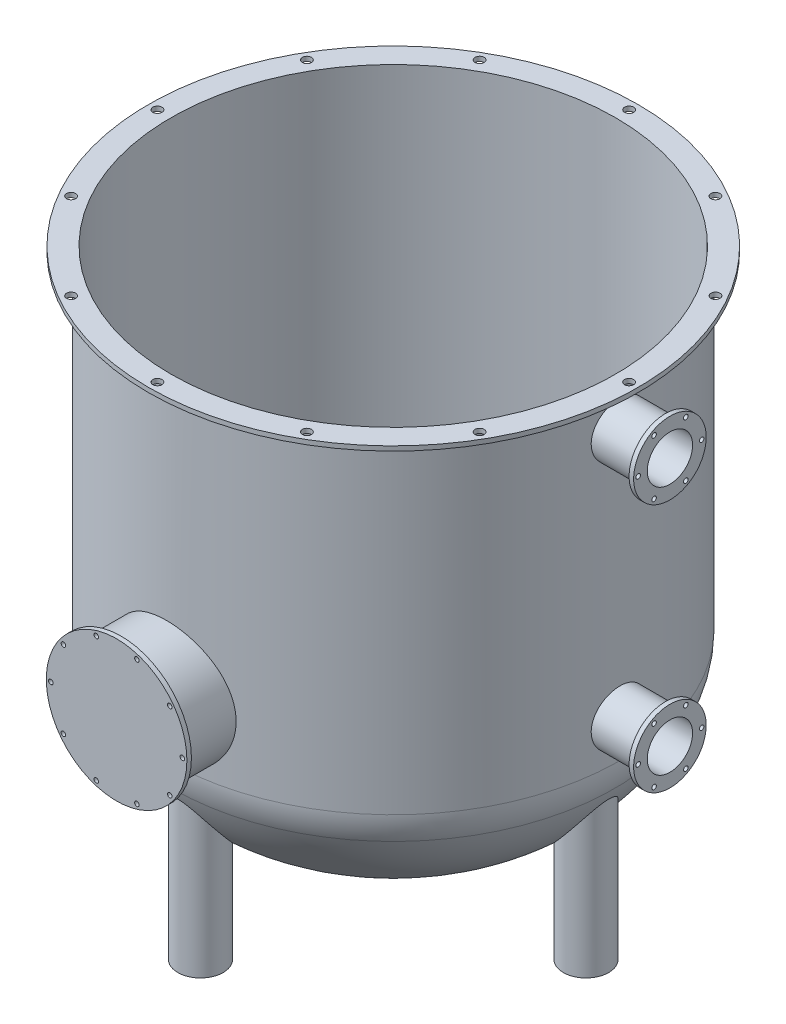
from build123d import *

# Parameters (mm, degrees)
BOSS_EXTRUDE1_START            = 2
SKETCH4_R                      = 108
SKETCH4_R_2                    = 98
SKETCH4_R_3                    = 2
BOSS_EXTRUDE1_DEPTH            = 2
BOSS_EXTRUDE3_REACH            = 278.094
BOSS_EXTRUDE3_END_MAJOR_RADIUS = 25
BOSS_EXTRUDE3_END_MINOR_RADIUS = 79.056941504
SKETCH5_R                      = 10
BOSS_EXTRUDE4_REACH            = 325.19
SKETCH8_R                      = 27
SKETCH9_R                      = 31
SKETCH9_R_2                    = 1
BOSS_EXTRUDE5_DEPTH            = 2
BOSS_EXTRUDE6_REACH            = 330.134
BOSS_EXTRUDE6_END_RADIUS       = 100
SKETCH10_R                     = 12
SKETCH11_R                     = 16
SKETCH11_R_2                   = 1
BOSS_EXTRUDE7_DEPTH            = 2
CUT_EXTRUDE1_REACH             = 331.527
CUT_EXTRUDE1_END_RADIUS        = 98
SKETCH12_R                     = 10


# Read off the part's stored shape, not the designer's step: Shell1
with BuildPart() as part:
    # Sketch3 → Revolve2 (revolve)
    with BuildSketch(Plane.XY, mode=Mode.PRIVATE) as revolve2_sk:
        with BuildLine():
            Line((0, 0), (0, 200))
            Line((0, 200), (100, 200))
            Line((100, 200), (100, 55.465837368))
            ThreePointArc((100, 55.465837368), (99.373212622, 49.365478338), (97.519041314, 43.520027845))
            ThreePointArc((97.519041314, 43.520027845), (57.218209568, 2.805907636), (0, 0))
        make_face()
    revolve(revolve2_sk.sketch.rotate(Axis((0, 0, 0), (0, 1, 0)), 90), axis=Axis((0, 0, 0), (0, 1, 0)))

    # Shell1 outline → Shell1 (revolve, cut)
    with BuildSketch(Plane.XY):
        with BuildLine():
            Line((98, 200), (0, 200))
            Line((0, 200), (0, 2.111233829))
            add(Edge.make_bspline(
                [(0, 2.111233829), (4.563355474, 0.546055917), (9.38894691, -0.709929005), (14.44451819, -1.596758461), (19.673863852, -2.056941505), (42.765340735, -2.056941501), (62.019063004, 3.120022694), (78.205892084, 14.695559438), (89.276902243, 29.555652696), (95.68443856, 44.316415147)],
                knots=[1.557153118, 1.557153118, 1.557153118, 1.557153118, 1.557153118, 1.557153118, 1.901211112, 1.901211112, 1.901211112, 1.901211112, 3.048817427, 3.048817427, 3.048817427, 3.048817427, 3.048817427, 3.048817427], degree=5, weights=[1, 1, 0.999996536, 0.999981952, 1, 1, 0.98894051, 0.991070019, 1, 1]))
            ThreePointArc((95.68443856, 44.316415147), (97.414998447, 49.772168941), (98, 55.465837368))
            Line((98, 55.465837368), (98, 200))
        make_face()
    revolve(axis=Axis((0, 0, 0), (0, 1, 0)), mode=Mode.SUBTRACT)

    # Sketch4 → Boss-Extrude1 (add)
    with BuildSketch(Plane(origin=(0, 200, 0), x_dir=(1, 0, 0), z_dir=(0, 1, 0)).offset(BOSS_EXTRUDE1_START)):
        with Locations(Location((0, 0, 0), (0, 0, 270))):
            Circle(SKETCH4_R)
        with Locations(Location((0, 0, 0), (0, 0, 90))):
            Circle(SKETCH4_R_2, mode=Mode.SUBTRACT)
        with Locations(Location((-104, 0, 0), (0, 0, 270))):
            Circle(SKETCH4_R_3, mode=Mode.SUBTRACT)
        with Locations(Location((-90.066641994, 52, 0), (0, 0, 270))):
            Circle(SKETCH4_R_3, mode=Mode.SUBTRACT)
        with Locations(Location((-52, 90.066641994, 0), (0, 0, 270))):
            Circle(SKETCH4_R_3, mode=Mode.SUBTRACT)
        with Locations(Location((0, 104, 0), (0, 0, 270))):
            Circle(SKETCH4_R_3, mode=Mode.SUBTRACT)
        with Locations(Location((52, 90.066641994, 0), (0, 0, 270))):
            Circle(SKETCH4_R_3, mode=Mode.SUBTRACT)
        with Locations(Location((90.066641994, 52, 0), (0, 0, 270))):
            Circle(SKETCH4_R_3, mode=Mode.SUBTRACT)
        with Locations(Location((104, 0, 0), (0, 0, 270))):
            Circle(SKETCH4_R_3, mode=Mode.SUBTRACT)
        with Locations(Location((90.066641994, -52, 0), (0, 0, 270))):
            Circle(SKETCH4_R_3, mode=Mode.SUBTRACT)
        with Locations(Location((52, -90.066641994, 0), (0, 0, 270))):
            Circle(SKETCH4_R_3, mode=Mode.SUBTRACT)
        with Locations(Location((0, -104, 0), (0, 0, 270))):
            Circle(SKETCH4_R_3, mode=Mode.SUBTRACT)
        with Locations(Location((-52, -90.066641994, 0), (0, 0, 270))):
            Circle(SKETCH4_R_3, mode=Mode.SUBTRACT)
        with Locations(Location((-90.066641994, -52, 0), (0, 0, 270))):
            Circle(SKETCH4_R_3, mode=Mode.SUBTRACT)
    extrude(amount=-BOSS_EXTRUDE1_DEPTH)

    # Boss-Extrude3: up to this torus (the profile starts outside it)
    boss_extrude3_end = Plane(origin=(0, 75, 0), z_dir=(0, -1, 0)) * Torus(BOSS_EXTRUDE3_END_MAJOR_RADIUS, BOSS_EXTRUDE3_END_MINOR_RADIUS, mode=Mode.PRIVATE)
    # Sketch5 → Boss-Extrude3 (add, up to the surface)
    with BuildSketch(Plane(origin=(0, -28, 0), x_dir=(1, 0, 0), z_dir=(0, 1, 0)), mode=Mode.PRIVATE) as boss_extrude3_sk1:
        with Locations(Location((-85, 0, 0), (0, 0, 30.589683297))):
            Circle(SKETCH5_R)
    boss_extrude3_tool1 = extrude(boss_extrude3_sk1.sketch, amount=BOSS_EXTRUDE3_REACH, mode=Mode.PRIVATE) - boss_extrude3_end
    add(boss_extrude3_tool1.solids().sort_by_distance((-85, -28, 0))[0])
    # Sketch5 → Boss-Extrude3 (add, up to the surface)
    with BuildSketch(Plane(origin=(0, -28, 0), x_dir=(1, 0, 0), z_dir=(0, 1, 0)), mode=Mode.PRIVATE) as boss_extrude3_sk2:
        with Locations(Location((0, 85, 0), (0, 0, 89.999999673))):
            Circle(SKETCH5_R)
    boss_extrude3_tool2 = extrude(boss_extrude3_sk2.sketch, amount=BOSS_EXTRUDE3_REACH, mode=Mode.PRIVATE) - boss_extrude3_end
    add(boss_extrude3_tool2.solids().sort_by_distance((0, -28, -85))[0])
    # Sketch5 → Boss-Extrude3 (add, up to the surface)
    with BuildSketch(Plane(origin=(0, -28, 0), x_dir=(1, 0, 0), z_dir=(0, 1, 0)), mode=Mode.PRIVATE) as boss_extrude3_sk3:
        with Locations(Location((85, 0, 0), (0, 0, 149.410316703))):
            Circle(SKETCH5_R)
    boss_extrude3_tool3 = extrude(boss_extrude3_sk3.sketch, amount=BOSS_EXTRUDE3_REACH, mode=Mode.PRIVATE) - boss_extrude3_end
    add(boss_extrude3_tool3.solids().sort_by_distance((85, -28, 0))[0])
    # Sketch5 → Boss-Extrude3 (add, up to the surface)
    with BuildSketch(Plane(origin=(0, -28, 0), x_dir=(1, 0, 0), z_dir=(0, 1, 0)), mode=Mode.PRIVATE) as boss_extrude3_sk4:
        with Locations(Location((0, -85, 0), (0, 0, 113.120613662))):
            Circle(SKETCH5_R)
    boss_extrude3_tool4 = extrude(boss_extrude3_sk4.sketch, amount=BOSS_EXTRUDE3_REACH, mode=Mode.PRIVATE) - boss_extrude3_end
    add(boss_extrude3_tool4.solids().sort_by_distance((0, -28, 85))[0])

    # Sketch8 → Boss-Extrude4 (add, up to next)
    with BuildSketch(Plane.XY.offset(120), mode=Mode.PRIVATE) as boss_extrude4_sk1:
        with Locations((0, 82)):
            Circle(SKETCH8_R)
    boss_extrude4_tool1 = extrude(boss_extrude4_sk1.sketch, amount=-BOSS_EXTRUDE4_REACH, mode=Mode.PRIVATE) - part.part
    add(boss_extrude4_tool1.solids().sort_by_distance((0, 82, 120))[0])

    # Sketch9 → Boss-Extrude5 (add)
    with BuildSketch(Plane.XY.offset(120)):
        with Locations((0, 82)):
            Circle(SKETCH9_R)
        with Locations((-29, 82)):
            Circle(SKETCH9_R_2, mode=Mode.SUBTRACT)
        with Locations((-23.461492837, 99.045772316)):
            Circle(SKETCH9_R_2, mode=Mode.SUBTRACT)
        with Locations((-8.961492837, 109.580638973)):
            Circle(SKETCH9_R_2, mode=Mode.SUBTRACT)
        with Locations((8.961492837, 109.580638973)):
            Circle(SKETCH9_R_2, mode=Mode.SUBTRACT)
        with Locations((23.461492837, 99.045772316)):
            Circle(SKETCH9_R_2, mode=Mode.SUBTRACT)
        with Locations((29, 82)):
            Circle(SKETCH9_R_2, mode=Mode.SUBTRACT)
        with Locations((23.461492837, 64.954227684)):
            Circle(SKETCH9_R_2, mode=Mode.SUBTRACT)
        with Locations((8.961492837, 54.419361027)):
            Circle(SKETCH9_R_2, mode=Mode.SUBTRACT)
        with Locations((-8.961492837, 54.419361027)):
            Circle(SKETCH9_R_2, mode=Mode.SUBTRACT)
        with Locations((-23.461492837, 64.954227684)):
            Circle(SKETCH9_R_2, mode=Mode.SUBTRACT)
    extrude(amount=BOSS_EXTRUDE5_DEPTH)

    # Boss-Extrude6: up to this cylinder (the profile starts outside it)
    boss_extrude6_end = Plane(origin=(0, 127, 0), z_dir=(0, -1, 0)) * Cylinder(BOSS_EXTRUDE6_END_RADIUS, 971.268, mode=Mode.PRIVATE)
    # Sketch10 → Boss-Extrude6 (add, up to the surface)
    with BuildSketch(Plane(origin=(120, 0, 0), x_dir=(0, 0, -1), z_dir=(1, 0, 0)), mode=Mode.PRIVATE) as boss_extrude6_sk1:
        with Locations((0, 182)):
            Circle(SKETCH10_R)
    boss_extrude6_tool1 = extrude(boss_extrude6_sk1.sketch, amount=-BOSS_EXTRUDE6_REACH, mode=Mode.PRIVATE) - boss_extrude6_end
    add(boss_extrude6_tool1.solids().sort_by_distance((120, 182, 0))[0])
    # Sketch10 → Boss-Extrude6 (add, up to the surface)
    with BuildSketch(Plane(origin=(120, 0, 0), x_dir=(0, 0, -1), z_dir=(1, 0, 0)), mode=Mode.PRIVATE) as boss_extrude6_sk2:
        with Locations((0, 72)):
            Circle(SKETCH10_R)
    boss_extrude6_tool2 = extrude(boss_extrude6_sk2.sketch, amount=-BOSS_EXTRUDE6_REACH, mode=Mode.PRIVATE) - boss_extrude6_end
    add(boss_extrude6_tool2.solids().sort_by_distance((120, 72, 0))[0])

    # Sketch11 → Boss-Extrude7 (add)
    # profile 1 of 2: a face of its own
    with BuildSketch(Plane(origin=(120, 0, 0), x_dir=(0, 0, -1), z_dir=(1, 0, 0))):
        with Locations((0, 182)):
            Circle(SKETCH11_R)
        with Locations((-14, 182)):
            Circle(SKETCH11_R_2, mode=Mode.SUBTRACT)
        with Locations((-7, 194.124355653)):
            Circle(SKETCH11_R_2, mode=Mode.SUBTRACT)
        with Locations((7, 194.124355653)):
            Circle(SKETCH11_R_2, mode=Mode.SUBTRACT)
        with Locations((14, 182)):
            Circle(SKETCH11_R_2, mode=Mode.SUBTRACT)
        with Locations((7, 169.875644347)):
            Circle(SKETCH11_R_2, mode=Mode.SUBTRACT)
        with Locations((-7, 169.875644347)):
            Circle(SKETCH11_R_2, mode=Mode.SUBTRACT)
    # profile 2 of 2: a face of its own
    with BuildSketch(Plane(origin=(120, 0, 0), x_dir=(0, 0, -1), z_dir=(1, 0, 0))):
        with Locations((0, 72)):
            Circle(SKETCH11_R)
        with Locations((-14, 72)):
            Circle(SKETCH11_R_2, mode=Mode.SUBTRACT)
        with Locations((-7, 84.124355653)):
            Circle(SKETCH11_R_2, mode=Mode.SUBTRACT)
        with Locations((7, 84.124355653)):
            Circle(SKETCH11_R_2, mode=Mode.SUBTRACT)
        with Locations((14, 72)):
            Circle(SKETCH11_R_2, mode=Mode.SUBTRACT)
        with Locations((7, 59.875644347)):
            Circle(SKETCH11_R_2, mode=Mode.SUBTRACT)
        with Locations((-7, 59.875644347)):
            Circle(SKETCH11_R_2, mode=Mode.SUBTRACT)
    extrude(amount=BOSS_EXTRUDE7_DEPTH)

    # Cut-Extrude1: up to this cylinder (the profile starts outside it)
    cut_extrude1_end = Plane(origin=(0, 127, 0), z_dir=(0, -1, 0)) * Cylinder(CUT_EXTRUDE1_END_RADIUS, 970.054, mode=Mode.PRIVATE)
    # Sketch12 → Cut-Extrude1 (cut, up to the surface)
    with BuildSketch(Plane(origin=(122, 0, 0), x_dir=(0, 0, -1), z_dir=(1, 0, 0)), mode=Mode.PRIVATE) as cut_extrude1_sk1:
        with Locations((0, 182)):
            Circle(SKETCH12_R)
    cut_extrude1_tool1 = extrude(cut_extrude1_sk1.sketch, amount=-CUT_EXTRUDE1_REACH, mode=Mode.PRIVATE) - cut_extrude1_end
    add(cut_extrude1_tool1.solids().sort_by_distance((122, 182, 0))[0], mode=Mode.SUBTRACT)
    # Sketch12 → Cut-Extrude1 (cut, up to the surface)
    with BuildSketch(Plane(origin=(122, 0, 0), x_dir=(0, 0, -1), z_dir=(1, 0, 0)), mode=Mode.PRIVATE) as cut_extrude1_sk2:
        with Locations((0, 72)):
            Circle(SKETCH12_R)
    cut_extrude1_tool2 = extrude(cut_extrude1_sk2.sketch, amount=-CUT_EXTRUDE1_REACH, mode=Mode.PRIVATE) - cut_extrude1_end
    add(cut_extrude1_tool2.solids().sort_by_distance((122, 72, 0))[0], mode=Mode.SUBTRACT)


solid = part.part
